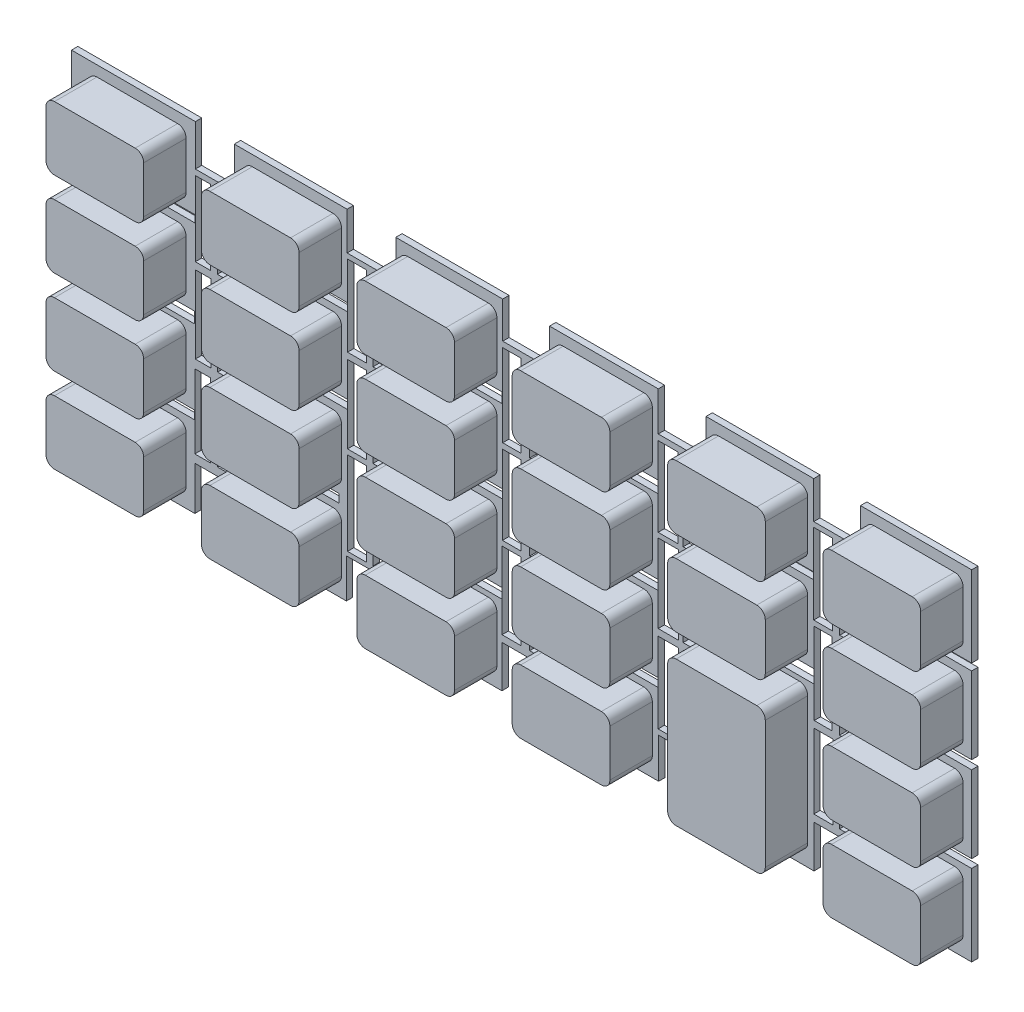
from build123d import *

# Parameters (mm, degrees)
SKETCH1_W           = 129
SKETCH1_H           = 44
MAIN_BODY_DEPTH     = 0.75
SKETCH2_W           = 11.5
SKETCH2_H           = 7.5
SKETCH2_H_2         = 17
BUTTON_BUMPS_DEPTH  = 5
SKETCH5_OUTSIDE_W   = 158.284
SKETCH5_OUTSIDE_H   = 73.284
SKETCH5_OUTSIDE_W_2 = 106
SKETCH5_OUTSIDE_H_2 = 40
CORNERS_CUT_DEPTH   = 69.331910554
SKETCH6_W           = 14.568246905
SKETCH6_H           = 0.848026086
SKETCH6_W_2         = 14.473154159
SKETCH6_H_2         = 1.304965198
SKETCH6_W_3         = 14.505342996
SKETCH6_H_3         = 0.995010591
SKETCH6_W_4         = 4.584155938
SKETCH6_H_4         = 4.837938583
SKETCH6_W_5         = 5.735657466
SKETCH6_H_5         = 4.463820683
SKETCH6_W_6         = 5.514427277
SKETCH6_H_6         = 4.297655594
SKETCH6_W_7         = 5.625874622
SKETCH6_H_7         = 4.60145766
SKETCH6_W_8         = 5.509315921
SKETCH6_H_8         = 4.386561833
SKETCH6_W_9         = 5.565026266
SKETCH6_H_9         = 4.608356471
SKETCH6_W_10        = 5.461498069
SKETCH6_H_10        = 4.941501962
SKETCH6_W_11        = 5.23921742
SKETCH6_H_11        = 4.704273636
SKETCH6_W_12        = 5.536198009
SKETCH6_H_12        = 4.979118435
SKETCH6_W_13        = 12.978627393
SKETCH6_H_13        = 1.030546684
SKETCH6_W_14        = 13.031992161
SKETCH6_H_14        = 0.803321969
SKETCH6_W_15        = 1.795745334
SKETCH6_H_15        = 8.793818954
SKETCH6_W_16        = 1.827354367
SKETCH6_H_16        = 8.687304669
SKETCH6_W_17        = 1.839474041
SKETCH6_H_17        = 9.113432621
SKETCH6_W_18        = 2.286939168
SKETCH6_H_18        = 9.107879913
SKETCH6_W_19        = 13.314460893
SKETCH6_H_19        = 0.929662497
SKETCH6_W_20        = 12.933087604
SKETCH6_W_21        = 12.05802686
SKETCH6_W_22        = 12.487068408
SKETCH6_H_20        = 1.186427825
SKETCH6_W_23        = 12.565634274
SKETCH6_W_24        = 12.527730598
SKETCH6_H_21        = 1.183295374
SKETCH6_W_25        = 12.631461592
SKETCH6_W_26        = 12.983810673
SKETCH6_W_27        = 2.567858478
SKETCH6_H_22        = 9.536701368
SKETCH6_W_28        = 2.495277917
SKETCH6_H_23        = 9.46787123
SKETCH6_W_29        = 2.676342604
SKETCH6_H_24        = 9.375115152
SKETCH6_W_30        = 2.401833493
SKETCH6_H_25        = 9.240031989
SKETCH6_W_31        = 2.199884459
SKETCH6_H_26        = 9.311628659
SKETCH6_W_32        = 2.40038967
SKETCH6_H_27        = 9.690454312
SKETCH6_W_33        = 2.241645238
SKETCH6_H_28        = 9.126088131
SKETCH6_W_34        = 2.719813585
SKETCH6_H_29        = 9.514216934
SKETCH6_W_35        = 2.263541763
SKETCH6_H_30        = 8.772923109
SKETCH6_W_36        = 2.103822083
SKETCH6_H_31        = 9.615272136
SKETCH6_W_37        = 2.195379414
SKETCH6_H_32        = 9.458263553
SKETCH6_W_38        = 2.367247324
SKETCH6_H_33        = 9.358946159
SKETCH6_W_39        = 2.175518118
SKETCH6_H_34        = 9.701561642
SKETCH6_W_40        = 2.23663232
SKETCH6_H_35        = 9.505102034
SKETCH6_W_41        = 2.657476109
SKETCH6_H_36        = 9.144698639
SKETCH6_W_42        = 2.243200893
SKETCH6_H_37        = 9.047380331
SKETCH6_W_43        = 2.736068121
SKETCH6_H_38        = 9.148032888
SKETCH6_W_44        = 1.995311805
SKETCH6_H_39        = 8.780212886
SKETCH6_W_45        = 2.232189122
SKETCH6_H_40        = 8.532256387
SKETCH6_W_46        = 4.925213805
SKETCH6_H_41        = 5.130419433
SKETCH6_H_42        = 9.852027825
SKETCH6_H_43        = 8.987451417
SKETCH6_W_47        = 2.340336211
SKETCH6_W_48        = 12.706733371
SKETCH6_H_44        = 1.393680034
SKETCH6_W_49        = 12.681499888
SKETCH6_H_45        = 1.125609041
SKETCH6_W_50        = 12.767958382
SKETCH6_H_46        = 9.461657873
SKETCH6_H_47        = 9.451630049
SKETCH6_W_51        = 12.647476461
SKETCH6_H_48        = 1.561474162
SKETCH6_H_49        = 8.680138858
INKEYS_CUT_DEPTH    = 57.868268832
BUTTON_SPACE_START  = -3
SKETCH7_W           = 6.75
SKETCH7_H           = 6.75
BUTTON_SPACE_DEPTH  = 3
FILLET1_R           = 1


with BuildPart() as part:
    # Sketch1 → main_body (new body)
    with BuildSketch(Plane.XY):
        Rectangle(SKETCH1_W, SKETCH1_H)
    extrude(amount=MAIN_BODY_DEPTH)

    # Sketch2 → button_bumps (add)
    with BuildSketch(Plane.XY.offset(0.75)):
        with Locations((-45.25, 15)):
            Rectangle(SKETCH2_W, SKETCH2_H)
        with Locations((-45.25, 5)):
            Rectangle(SKETCH2_W, SKETCH2_H)
        with Locations((-26.95, 5)):
            Rectangle(SKETCH2_W, SKETCH2_H)
        with Locations((-8.65, 5)):
            Rectangle(SKETCH2_W, SKETCH2_H)
        with Locations((9.65, 5)):
            Rectangle(SKETCH2_W, SKETCH2_H)
        with Locations((27.95, 5)):
            Rectangle(SKETCH2_W, SKETCH2_H)
        with Locations((46.25, -5)):
            Rectangle(SKETCH2_W, SKETCH2_H)
        with Locations((46.25, -15)):
            Rectangle(SKETCH2_W, SKETCH2_H)
        with Locations((46.25, 15)):
            Rectangle(SKETCH2_W, SKETCH2_H)
        with Locations((-45.25, -5)):
            Rectangle(SKETCH2_W, SKETCH2_H)
        with Locations((-45.25, -15)):
            Rectangle(SKETCH2_W, SKETCH2_H)
        with Locations((-26.95, 15)):
            Rectangle(SKETCH2_W, SKETCH2_H)
        with Locations((-26.95, -5)):
            Rectangle(SKETCH2_W, SKETCH2_H)
        with Locations((-26.95, -15)):
            Rectangle(SKETCH2_W, SKETCH2_H)
        with Locations((-8.65, -5)):
            Rectangle(SKETCH2_W, SKETCH2_H)
        with Locations((-8.65, -15)):
            Rectangle(SKETCH2_W, SKETCH2_H)
        with Locations((-8.65, 15)):
            Rectangle(SKETCH2_W, SKETCH2_H)
        with Locations((9.65, 15)):
            Rectangle(SKETCH2_W, SKETCH2_H)
        with Locations((9.65, -5)):
            Rectangle(SKETCH2_W, SKETCH2_H)
        with Locations((9.65, -15)):
            Rectangle(SKETCH2_W, SKETCH2_H)
        with Locations((27.95, 15)):
            Rectangle(SKETCH2_W, SKETCH2_H)
        with Locations((46.25, 5)):
            Rectangle(SKETCH2_W, SKETCH2_H)
        with Locations((27.95, -10)):
            Rectangle(SKETCH2_W, SKETCH2_H_2)
    extrude(amount=BUTTON_BUMPS_DEPTH)

    # Sketch5 outside → corners_cut (cut, through all)
    with BuildSketch(Plane.XY.offset(0.75)):
        Rectangle(SKETCH5_OUTSIDE_W, SKETCH5_OUTSIDE_H)
        Rectangle(SKETCH5_OUTSIDE_W_2, SKETCH5_OUTSIDE_H_2, mode=Mode.SUBTRACT)
    extrude(amount=-CORNERS_CUT_DEPTH, mode=Mode.SUBTRACT)

    # Sketch6 → inkeys_cut (cut, through all)
    with BuildSketch(Plane.XY.offset(0.75)):
        with Locations((-45.715876548, 10.062979309)):
            Rectangle(SKETCH6_W, SKETCH6_H)
        with Locations((-45.763422921, -0.024683031)):
            Rectangle(SKETCH6_W_2, SKETCH6_H_2)
        with Locations((-45.747328502, -9.961956009)):
            Rectangle(SKETCH6_W_3, SKETCH6_H_3)
        with Locations((-36.12036384, 17.581030709)):
            Rectangle(SKETCH6_W_4, SKETCH6_H_4)
        with Locations((-17.678703451, 17.768089658)):
            Rectangle(SKETCH6_W_5, SKETCH6_H_5)
        with Locations((0.536541957, 17.851172203)):
            Rectangle(SKETCH6_W_6, SKETCH6_H_6)
        with Locations((18.908881842, 17.69927117)):
            Rectangle(SKETCH6_W_7, SKETCH6_H_7)
        with Locations((37.156358346, 17.806719083)):
            Rectangle(SKETCH6_W_8, SKETCH6_H_8)
        with Locations((-17.847969843, -17.695821764)):
            Rectangle(SKETCH6_W_9, SKETCH6_H_9)
        with Locations((0.418907381, -17.529249019)):
            Rectangle(SKETCH6_W_10, SKETCH6_H_10)
        with Locations((18.761224565, -17.647863182)):
            Rectangle(SKETCH6_W_11, SKETCH6_H_11)
        with Locations((37.204414304, -17.510440783)):
            Rectangle(SKETCH6_W_12, SKETCH6_H_12)
        with Locations((46.510686304, 0.112526226)):
            Rectangle(SKETCH6_W_13, SKETCH6_H_13)
        with Locations((46.484003919, 10.085331368)):
            Rectangle(SKETCH6_W_14, SKETCH6_H_14)
        with Locations((-37.514569142, 10.103721978)):
            Rectangle(SKETCH6_W_15, SKETCH6_H_15)
        with Locations((-37.561810855, -9.581202914)):
            Rectangle(SKETCH6_W_16, SKETCH6_H_16)
        with Locations((-37.50398771, 0.333322626)):
            Rectangle(SKETCH6_W_17, SKETCH6_H_17)
        with Locations((-34.64986401, 0.312607174)):
            Rectangle(SKETCH6_W_18, SKETCH6_H_18)
        with Locations((-27.16180613, 10.022161104)):
            Rectangle(SKETCH6_W_19, SKETCH6_H_19)
        with Locations((-26.97609886, 0.112526226)):
            Rectangle(SKETCH6_W_20, SKETCH6_H_13)
        with Locations((-27.505632749, -9.961956009)):
            Rectangle(SKETCH6_W_21, SKETCH6_H_3)
        with Locations((-8.52639711, 9.89377844)):
            Rectangle(SKETCH6_W_22, SKETCH6_H_20)
        with Locations((-8.551534653, 0.112526226)):
            Rectangle(SKETCH6_W_23, SKETCH6_H_13)
        with Locations((-8.572532797, -10.056098401)):
            Rectangle(SKETCH6_W_24, SKETCH6_H_21)
        with Locations((28.052139988, 10.085331368)):
            Rectangle(SKETCH6_W_25, SKETCH6_H_14)
        with Locations((46.519429734, -9.961956009)):
            Rectangle(SKETCH6_W_26, SKETCH6_H_3)
        with Locations((38.727072276, 0.118770263)):
            Rectangle(SKETCH6_W_27, SKETCH6_H_22)
        with Locations((38.707492977, 10.285902794)):
            Rectangle(SKETCH6_W_28, SKETCH6_H_23)
        with Locations((20.367578698, 10.045379944)):
            Rectangle(SKETCH6_W_29, SKETCH6_H_24)
        with Locations((17.282006841, 0.16984368)):
            Rectangle(SKETCH6_W_30, SKETCH6_H_25)
        with Locations((-1.155824946, 0.029447447)):
            Rectangle(SKETCH6_W_31, SKETCH6_H_26)
        with Locations((2.15361422, 10.221756657)):
            Rectangle(SKETCH6_W_32, SKETCH6_H_27)
        with Locations((-19.37584849, 0.143606)):
            Rectangle(SKETCH6_W_33, SKETCH6_H_28)
        with Locations((-16.148075549, 10.198611222)):
            Rectangle(SKETCH6_W_34, SKETCH6_H_29)
        with Locations((35.548570556, -9.817268635)):
            Rectangle(SKETCH6_W_35, SKETCH6_H_30)
        with Locations((35.510371132, 0.16433252)):
            Rectangle(SKETCH6_W_36, SKETCH6_H_31)
        with Locations((35.499390092, 10.301590284)):
            Rectangle(SKETCH6_W_37, SKETCH6_H_32)
        with Locations((17.268349373, 10.042296988)):
            Rectangle(SKETCH6_W_38, SKETCH6_H_33)
        with Locations((-1.132912622, 10.193149893)):
            Rectangle(SKETCH6_W_39, SKETCH6_H_34)
        with Locations((-19.373849603, 10.194053772)):
            Rectangle(SKETCH6_W_40, SKETCH6_H_35)
        with Locations((-16.174846497, 0.155205002)):
            Rectangle(SKETCH6_W_41, SKETCH6_H_36)
        with Locations((-1.177394124, -9.750442882)):
            Rectangle(SKETCH6_W_42, SKETCH6_H_37)
        with Locations((20.389806416, 0.15904243)):
            Rectangle(SKETCH6_W_43, SKETCH6_H_38)
        with Locations((-34.825941774, 10.110525012)):
            Rectangle(SKETCH6_W_44, SKETCH6_H_39)
        with Locations((-34.677239033, -9.658727054)):
            Rectangle(SKETCH6_W_45, SKETCH6_H_40)
        with Locations((-36.012881136, -17.435758405)):
            Rectangle(SKETCH6_W_46, SKETCH6_H_41)
        with Locations((-19.37584849, -9.944534777)):
            Rectangle(SKETCH6_W_33, SKETCH6_H_42)
        with Locations((-16.174846497, -9.944534777)):
            Rectangle(SKETCH6_W_41, SKETCH6_H_42)
        with Locations((2.15361422, -0.132641173)):
            Rectangle(SKETCH6_W_32, SKETCH6_H_43)
        with Locations((2.12358749, -9.750442882)):
            Rectangle(SKETCH6_W_47, SKETCH6_H_37)
        with Locations((9.716769331, 9.988067422)):
            Rectangle(SKETCH6_W_48, SKETCH6_H_44)
        with Locations((9.710108557, -0.013313814)):
            Rectangle(SKETCH6_W_49, SKETCH6_H_45)
        with Locations((9.69128785, -9.961956009)):
            Rectangle(SKETCH6_W_50, SKETCH6_H_3)
        with Locations((17.282006841, -9.957581654)):
            Rectangle(SKETCH6_W_30, SKETCH6_H_46)
        with Locations((20.389806416, -9.962595565)):
            Rectangle(SKETCH6_W_43, SKETCH6_H_47)
        with Locations((28.108917943, -0.152937513)):
            Rectangle(SKETCH6_W_51, SKETCH6_H_48)
        with Locations((38.727072276, -9.86366076)):
            Rectangle(SKETCH6_W_27, SKETCH6_H_49)
    extrude(amount=-INKEYS_CUT_DEPTH, mode=Mode.SUBTRACT)

    # Sketch7 → button_space (cut)
    with BuildSketch(Plane.XY.offset(5.75).offset(BUTTON_SPACE_START)):
        with Locations((-45.25, 15)):
            Rectangle(SKETCH7_W, SKETCH7_H)
        with Locations((-45.25, 5)):
            Rectangle(SKETCH7_W, SKETCH7_H)
        with Locations((-45.25, -5)):
            Rectangle(SKETCH7_W, SKETCH7_H)
        with Locations((-45.25, -15)):
            Rectangle(SKETCH7_W, SKETCH7_H)
        with Locations((-26.95, 15)):
            Rectangle(SKETCH7_W, SKETCH7_H)
        with Locations((-26.95, 5)):
            Rectangle(SKETCH7_W, SKETCH7_H)
        with Locations((-26.95, -5)):
            Rectangle(SKETCH7_W, SKETCH7_H)
        with Locations((-26.95, -15)):
            Rectangle(SKETCH7_W, SKETCH7_H)
        with Locations((-8.65, 15)):
            Rectangle(SKETCH7_W, SKETCH7_H)
        with Locations((-8.65, 5)):
            Rectangle(SKETCH7_W, SKETCH7_H)
        with Locations((-8.65, -5)):
            Rectangle(SKETCH7_W, SKETCH7_H)
        with Locations((-8.65, -15)):
            Rectangle(SKETCH7_W, SKETCH7_H)
        with Locations((9.65, -15)):
            Rectangle(SKETCH7_W, SKETCH7_H)
        with Locations((9.65, -5)):
            Rectangle(SKETCH7_W, SKETCH7_H)
        with Locations((9.65, 5)):
            Rectangle(SKETCH7_W, SKETCH7_H)
        with Locations((9.65, 15)):
            Rectangle(SKETCH7_W, SKETCH7_H)
        with Locations((27.95, 15)):
            Rectangle(SKETCH7_W, SKETCH7_H)
        with Locations((27.95, 5)):
            Rectangle(SKETCH7_W, SKETCH7_H)
        with Locations((46.25, 15)):
            Rectangle(SKETCH7_W, SKETCH7_H)
        with Locations((46.25, 5)):
            Rectangle(SKETCH7_W, SKETCH7_H)
        with Locations((46.25, -5)):
            Rectangle(SKETCH7_W, SKETCH7_H)
        with Locations((46.25, -15)):
            Rectangle(SKETCH7_W, SKETCH7_H)
        with Locations((27.95, -10)):
            Rectangle(SKETCH7_W, SKETCH7_H)
    extrude(amount=-BUTTON_SPACE_DEPTH, mode=Mode.SUBTRACT)

    # Fillet1
    fillet1_edges = [part.edges().sort_by_distance(p)[0] for p in [
        (-2.9, 18.75, 3.25),
        (-14.4, 18.75, 3.25),
        (-14.4, 11.25, 3.25),
        (-2.9, 11.25, 3.25),
        (-14.4, 8.75, 3.25),
        (-2.9, 8.75, 3.25),
        (-2.9, 1.25, 3.25),
        (-14.4, 1.25, 3.25),
        (-14.4, -1.25, 3.25),
        (-2.9, -1.25, 3.25),
        (-2.9, -8.75, 3.25),
        (-14.4, -8.75, 3.25),
        (-14.4, -11.25, 3.25),
        (-14.4, -18.75, 3.25),
        (-2.9, -11.25, 3.25),
        (-2.9, -18.75, 3.25),
        (-32.7, 18.75, 3.25),
        (-21.2, 18.75, 3.25),
        (-21.2, 11.25, 3.25),
        (-32.7, 11.25, 3.25),
        (-32.7, 8.75, 3.25),
        (-32.7, 1.25, 3.25),
        (-21.2, 8.75, 3.25),
        (-21.2, 1.25, 3.25),
        (-32.7, -1.25, 3.25),
        (-21.2, -1.25, 3.25),
        (-21.2, -8.75, 3.25),
        (-32.7, -8.75, 3.25),
        (-32.7, -11.25, 3.25),
        (-32.7, -18.75, 3.25),
        (-21.2, -11.25, 3.25),
        (-21.2, -18.75, 3.25),
        (-51, 18.75, 3.25),
        (-51, 11.25, 3.25),
        (-39.5, 11.25, 3.25),
        (-39.5, 18.75, 3.25),
        (-51, 8.75, 3.25),
        (-51, 1.25, 3.25),
        (-39.5, 8.75, 3.25),
        (-39.5, 1.25, 3.25),
        (-51, -1.25, 3.25),
        (-39.5, -1.25, 3.25),
        (-39.5, -8.75, 3.25),
        (-51, -8.75, 3.25),
        (-51, -11.25, 3.25),
        (-39.5, -11.25, 3.25),
        (-51, -18.75, 3.25),
        (-39.5, -18.75, 3.25),
        (40.5, 18.75, 3.25),
        (52, 18.75, 3.25),
        (40.5, 11.25, 3.25),
        (52, 11.25, 3.25),
        (40.5, 8.75, 3.25),
        (40.5, 1.25, 3.25),
        (52, 8.75, 3.25),
        (52, 1.25, 3.25),
        (40.5, -1.25, 3.25),
        (40.5, -8.75, 3.25),
        (52, -1.25, 3.25),
        (52, -8.75, 3.25),
        (40.5, -11.25, 3.25),
        (52, -11.25, 3.25),
        (40.5, -18.75, 3.25),
        (52, -18.75, 3.25),
        (22.2, 18.75, 3.25),
        (33.7, 18.75, 3.25),
        (33.7, 11.25, 3.25),
        (22.2, 11.25, 3.25),
        (22.2, 8.75, 3.25),
        (33.7, 8.75, 3.25),
        (33.7, 1.25, 3.25),
        (22.2, 1.25, 3.25),
        (22.2, -1.5, 3.25),
        (33.7, -1.5, 3.25),
        (22.2, -18.5, 3.25),
        (33.7, -18.5, 3.25),
        (3.9, 18.75, 3.25),
        (3.9, 11.25, 3.25),
        (15.4, 18.75, 3.25),
        (15.4, 11.25, 3.25),
        (3.9, 8.75, 3.25),
        (3.9, 1.25, 3.25),
        (15.4, 8.75, 3.25),
        (15.4, 1.25, 3.25),
        (3.9, -1.25, 3.25),
        (3.9, -8.75, 3.25),
        (15.4, -1.25, 3.25),
        (15.4, -8.75, 3.25),
        (3.9, -11.25, 3.25),
        (15.4, -11.25, 3.25),
        (3.9, -18.75, 3.25),
        (15.4, -18.75, 3.25),
    ]]
    fillet(fillet1_edges, radius=FILLET1_R)


solid = part.part
